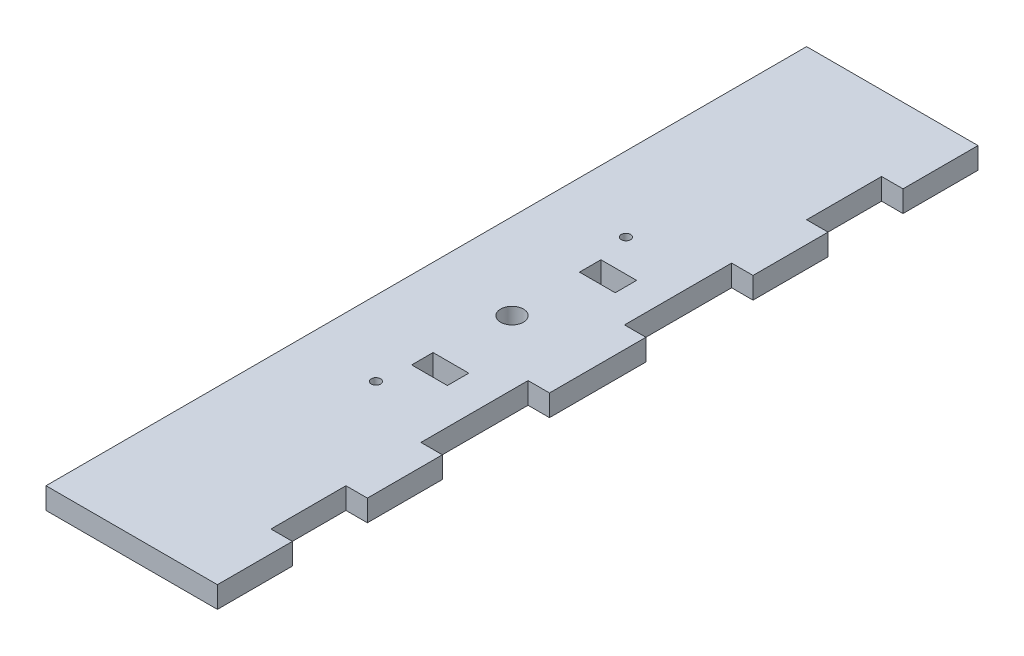
from build123d import *

# Parameters (mm, degrees)
SKETCH1_W           = 48
SKETCH1_H           = 213
SKETCH1_R           = 3.2
BOSS_EXTRUDE1_DEPTH = 6
SKETCH2_W           = 6
SKETCH2_H           = 21
SKETCH2_H_2         = 30
CUT_EXTRUDE1_DEPTH  = 110.335492865
SKETCH3_W           = 10
SKETCH3_H           = 6
CUT_EXTRUDE2_DEPTH  = 110.335492865
SKETCH4_R           = 1.3
CUT_EXTRUDE3_DEPTH  = 110.335492865


with BuildPart() as part:
    # Sketch1 → Boss-Extrude1 (new body)
    with BuildSketch(Plane(origin=(0, 0, 0), x_dir=(1, 0, 0), z_dir=(0, 1, 0))):
        Rectangle(SKETCH1_W, SKETCH1_H)
        Circle(SKETCH1_R, mode=Mode.SUBTRACT)
    extrude(amount=BOSS_EXTRUDE1_DEPTH)

    # Sketch2 → Cut-Extrude1 (cut, through all)
    with BuildSketch(Plane(origin=(0, 6, 0), x_dir=(1, 0, 0), z_dir=(0, 1, 0))):
        with Locations((21, 75)):
            Rectangle(SKETCH2_W, SKETCH2_H)
        with Locations((21, 28.5)):
            Rectangle(SKETCH2_W, SKETCH2_H_2)
        with Locations((21, -28.5)):
            Rectangle(SKETCH2_W, SKETCH2_H_2)
        with Locations((21, -75)):
            Rectangle(SKETCH2_W, SKETCH2_H)
    extrude(amount=-CUT_EXTRUDE1_DEPTH, mode=Mode.SUBTRACT)

    # Sketch3 → Cut-Extrude2 (cut, through all)
    with BuildSketch(Plane(origin=(0, 6, 0), x_dir=(1, 0, 0), z_dir=(0, 1, 0))):
        with Locations((2.9, -23)):
            Rectangle(SKETCH3_W, SKETCH3_H)
        with Locations((3.9, 23)):
            Rectangle(SKETCH3_W, SKETCH3_H)
    extrude(amount=-CUT_EXTRUDE2_DEPTH, mode=Mode.SUBTRACT)

    # Sketch4 → Cut-Extrude3 (cut, through all)
    with BuildSketch(Plane(origin=(0, 6, 0), x_dir=(1, 0, 0), z_dir=(0, 1, 0))):
        with Locations((-3.1, -35)):
            Circle(SKETCH4_R)
        with Locations((-3.1, 35)):
            Circle(SKETCH4_R)
    extrude(amount=-CUT_EXTRUDE3_DEPTH, mode=Mode.SUBTRACT)


solid = part.part
